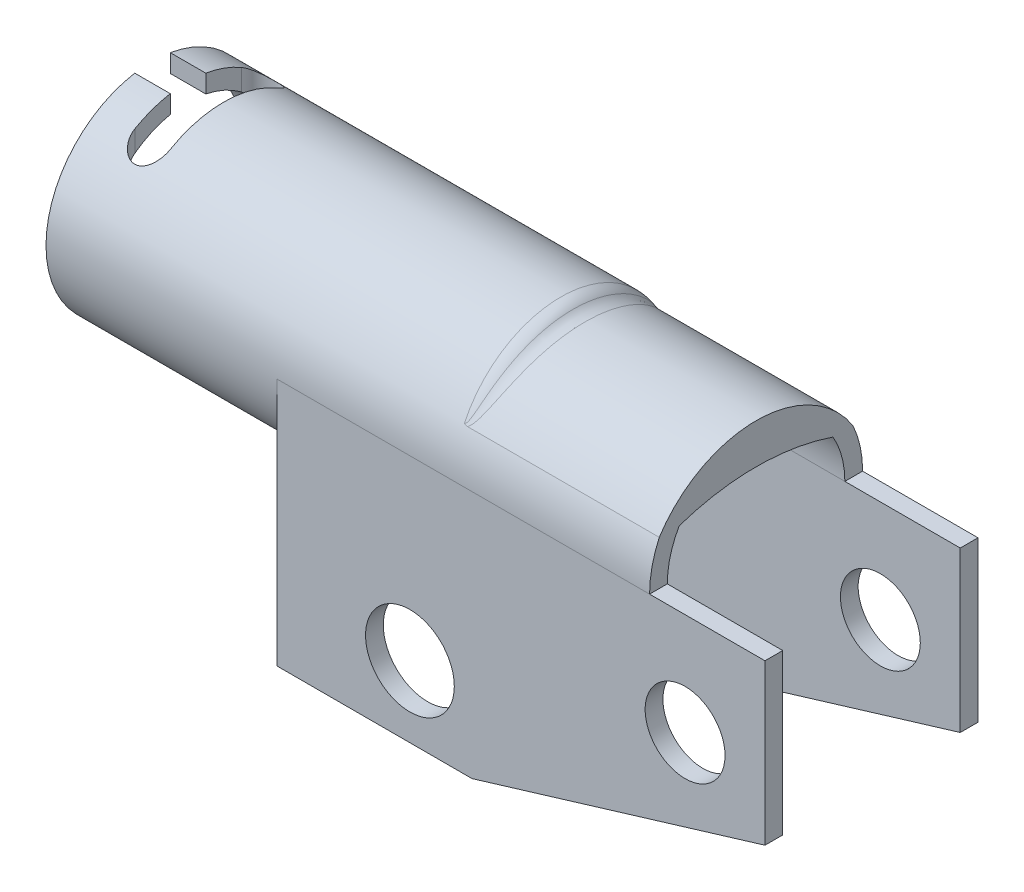
from build123d import *
from build123d.topology import SkipClean

# Parameters (mm, degrees)
SKETCH1_R               = 12
SKETCH1_R_2             = 10
EXTRUDE_THIN1_DEPTH     = 48
CUT_EXTRUDE1_DEPTH      = 51.911688245
CUT_EXTRUDE1_DEPTH_BACK = 51.911688245
SKETCH2_R               = 5
SKETCH2_R_2             = 4.5
BOSS_EXTRUDE1_START     = 10
SKETCH2_3_R             = 5
SKETCH2_3_R_2           = 4.5
BOSS_EXTRUDE1_DEPTH     = 2
BOSS_EXTRUDE2_START     = 20
BOSS_EXTRUDE2_DEPTH     = 20
FILLET1_R               = 2
FILLET2_R               = 2
SKETCH4_W               = 4
SKETCH4_H               = 4
CUT_EXTRUDE2_DEPTH      = 57.85068172


with BuildPart() as part:
    # Sketch1 → Extrude-Thin1 (new body)
    with BuildSketch(Plane(origin=(0, 0, 0), x_dir=(0, 0, -1), z_dir=(1, 0, 0))):
        Circle(SKETCH1_R)
        Circle(SKETCH1_R_2, mode=Mode.SUBTRACT)
    extrude(amount=-EXTRUDE_THIN1_DEPTH)

    # Sketch2 → Cut-Extrude1 (cut, two sides: drawn at the far end of the back side and taken through both)
    with BuildSketch(Plane.XY.offset(-CUT_EXTRUDE1_DEPTH_BACK)):
        Polygon((0, -28), (33, -18), (33, 0), (-22, 0), (-22, -28), align=None)
        with Locations((-7, -20)):
            Circle(SKETCH2_R, mode=Mode.SUBTRACT)
        with Locations((24, -11.5)):
            Circle(SKETCH2_R_2, mode=Mode.SUBTRACT)
    extrude(amount=CUT_EXTRUDE1_DEPTH + CUT_EXTRUDE1_DEPTH_BACK, mode=Mode.SUBTRACT)


with BuildPart() as body_2:
    # Sketch2<3> → Boss-Extrude1 (new body)
    with BuildSketch(Plane.XY.offset(BOSS_EXTRUDE1_START)):
        Polygon((0, -28), (33, -18), (33, 0), (-22, 0), (-22, -28), align=None)
        with Locations((-7, -20)):
            Circle(SKETCH2_3_R, mode=Mode.SUBTRACT)
        with Locations((24, -11.5)):
            Circle(SKETCH2_3_R_2, mode=Mode.SUBTRACT)
    boss_extrude1 = extrude(amount=BOSS_EXTRUDE1_DEPTH)


with BuildPart() as part_1:
    add(part.part)

    # Mirror2: Boss-Extrude1 across plane
    add(boss_extrude1.mirror(Plane.XY))

    with SkipClean():  # the faces are left unmerged after this step: merging them gives an invalid solid
        add(body_2.part)  # Boss-Extrude2 merges body 2
        # Sketch3 → Boss-Extrude2 (add)
        with BuildSketch(Plane(origin=(0, 0, 0), x_dir=(0, 0, -1), z_dir=(1, 0, 0)).offset(BOSS_EXTRUDE2_START)):
            with BuildLine():
                Line((-12, 0), (-10, 0))
                ThreePointArc((-10, 0), (-9.659258263, 2.588190451), (-8.660254038, 5))
                ThreePointArc((-8.660254038, 5), (0, 6.426576295), (8.660254038, 5))
                ThreePointArc((8.660254038, 5), (9.659258263, 2.588190451), (10, 0))
                Line((10, 0), (12, 0))
                ThreePointArc((12, 0), (11.724004123, 2.558852734), (10.908712115, 5))
                ThreePointArc((10.908712115, 5), (0, 10.928932188), (-10.908712115, 5))
                ThreePointArc((-10.908712115, 5), (-11.724004123, 2.558852734), (-12, 0))
            make_face()
        extrude(amount=-BOSS_EXTRUDE2_DEPTH)

    # Fillet1
    # the kernel refuses this fillet: 2 mm, written as the material it adds along each edge
    # the kernel refuses this fillet: 2 mm, written as the material it takes off along each edge
    with BuildSketch(Plane(origin=(0, 0, 0), x_dir=(0, 0.012755038340964423, -0.9999186511896457), z_dir=(0, -0.9999186511896457, -0.012755038340964423))) as fillet1_2_piece_1_section:
        with BuildLine():
            CenterArc((12 - FILLET1_R, -FILLET1_R), FILLET1_R, 0, 90)
            Line((12 - FILLET1_R, 0), (12, 0))
            Line((12, 0), (12, -FILLET1_R))
        make_face()
    fillet1_2_piece_1 = revolve(axis=Axis((0, 0, 0), (1, 0, 0)), revolution_arc=178.538340636, mode=Mode.PRIVATE)
    fillet1_2_piece_1 = fillet1_2_piece_1 - Plane(origin=(-0.951846568, -2.071067812, 0), x_dir=(0, 0.5439282932204216, -0.839131701125824), z_dir=(1, 0, 0)) * Cylinder(13, 49, mode=Mode.PRIVATE)
    add(fillet1_2_piece_1, mode=Mode.SUBTRACT)

    # Fillet2
    fillet2_edges = [part_1.edges().sort_by_distance(p)[0] for p in [
        (-0.228818194, 10.928932188, -2e-09),
    ]]
    fillet(fillet2_edges, radius=FILLET2_R)

    # Sketch4 → Cut-Extrude2 (cut, through all)
    with BuildSketch(Plane(origin=(0, 0, 0), x_dir=(1, 0, 0), z_dir=(0, 1, 0))):
        with BuildLine():
            Line((-44, 2), (-44, -2))
            Line((-44, -2), (-44, -6))
            ThreePointArc((-44, -6), (-42, -8), (-40, -6))
            Line((-40, -6), (-40, 6))
            ThreePointArc((-40, 6), (-42, 8), (-44, 6))
            Line((-44, 6), (-44, 2))
        make_face()
        with Locations((-46, 0)):
            Rectangle(SKETCH4_W, SKETCH4_H)
    extrude(amount=CUT_EXTRUDE2_DEPTH, mode=Mode.SUBTRACT)


solid = part_1.part
